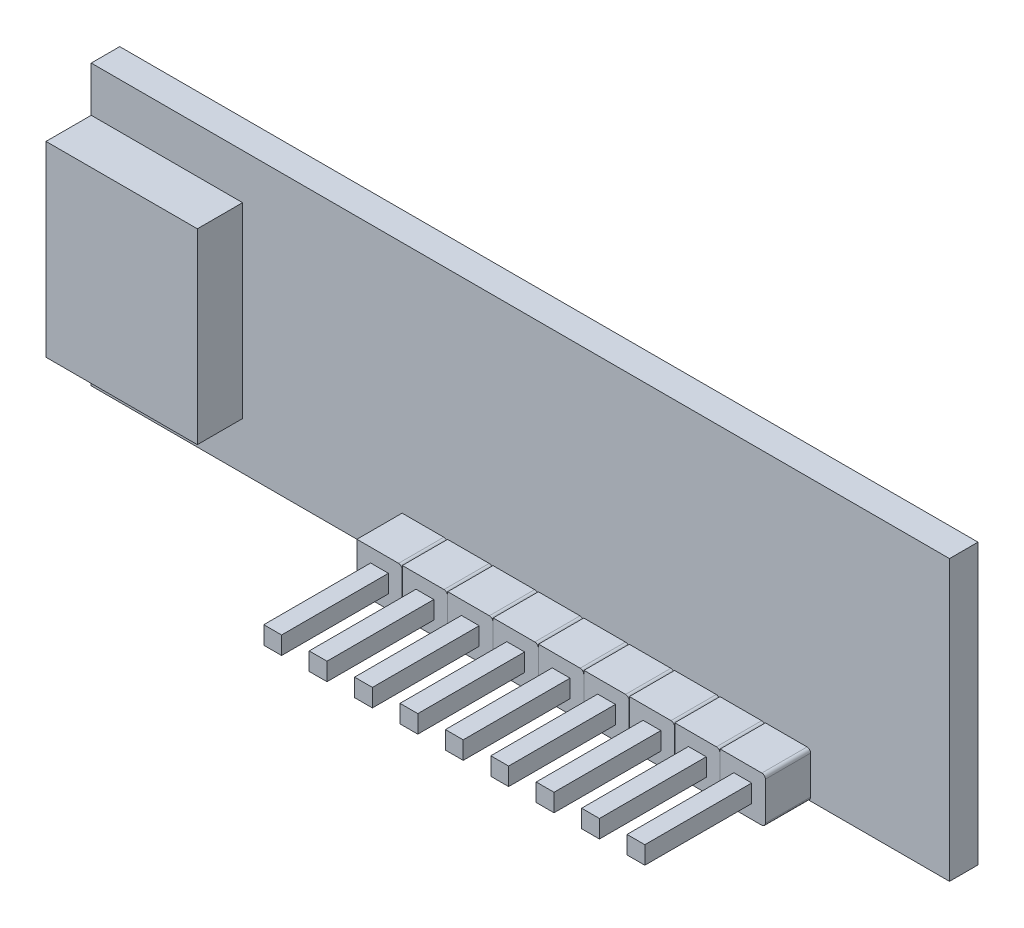
from build123d import *

# Parameters (mm, degrees)
SKETCH1_W             = 48.2
SKETCH1_H             = 15.7
MAIN_DEPTH            = 1.6
SKETCH2_W             = 2.54
SKETCH2_H             = 2.54
PINBASE_DEPTH         = 2.54
FILLET1_R             = 0.2
SKETCH3_W             = 1
SKETCH3_H             = 1
BOSS_EXTRUDE3_DEPTH   = 6
LPATTERN3_START       = 1.6
LPATTERN3_DEPTH       = 2.54
LPATTERN3_START_2     = -1.86
LPATTERN3_2_OUTLINE_W = 1
LPATTERN3_2_OUTLINE_H = 1
LPATTERN3_2_DEPTH     = 12
SKETCH5_W             = 8.5
SKETCH5_H             = 10.5
BOSS_EXTRUDE4_DEPTH   = 2.54
SKETCH6_W             = 1.8
SKETCH6_H             = 1.8
CUT_EXTRUDE1_DEPTH    = 6


# Read off the part's stored shape, not the designer's step: LPattern3
with BuildPart() as part:
    # Sketch1 → Main (new body)
    with BuildSketch(Plane.XY):
        Rectangle(SKETCH1_W, SKETCH1_H)
    extrude(amount=MAIN_DEPTH)

    # Sketch2 → PinBase (add)
    with BuildSketch(Plane.XY.offset(1.6)):
        with Locations((15.03, -6.58)):
            Rectangle(SKETCH2_W, SKETCH2_H)
    extrude(amount=PINBASE_DEPTH)

    # Fillet1
    fillet1_edges = [part.edges().sort_by_distance(p)[0] for p in [
        (13.76, -7.85, 2.87),
        (16.3, -7.85, 2.87),
        (16.3, -5.31, 2.87),
    ]]
    fillet(fillet1_edges, radius=FILLET1_R)

    # Sketch3 → Boss-Extrude3 (add, symmetric)
    with BuildSketch(Plane.XY.offset(4.14)):
        with Locations((15.03, -6.58)):
            Rectangle(SKETCH3_W, SKETCH3_H)
    extrude(amount=BOSS_EXTRUDE3_DEPTH, both=True)

    # LPattern3 outline → LPattern3 (add)
    with BuildSketch(Plane.XY.offset(LPATTERN3_START)):
        with BuildLine():
            Line((-6.44, -7.85), (-4.3, -7.85))
            ThreePointArc((-4.3, -7.85), (-4.158578644, -7.791421356), (-4.1, -7.65))
            Line((-4.1, -7.65), (-4.1, -5.51))
            ThreePointArc((-4.1, -5.51), (-4.158578644, -5.368578644), (-4.3, -5.31))
            Line((-4.3, -5.31), (-6.64, -5.31))
            Line((-6.64, -5.31), (-6.64, -7.65))
            ThreePointArc((-6.64, -7.65), (-6.581421356, -7.791421356), (-6.44, -7.85))
        make_face()
        with BuildLine():
            Line((-3.89, -7.85), (-1.75, -7.85))
            ThreePointArc((-1.75, -7.85), (-1.608578644, -7.791421356), (-1.55, -7.65))
            Line((-1.55, -7.65), (-1.55, -5.51))
            ThreePointArc((-1.55, -5.51), (-1.608578644, -5.368578644), (-1.75, -5.31))
            Line((-1.75, -5.31), (-4.09, -5.31))
            Line((-4.09, -5.31), (-4.09, -7.65))
            ThreePointArc((-4.09, -7.65), (-4.031421356, -7.791421356), (-3.89, -7.85))
        make_face()
        with BuildLine():
            Line((-1.34, -7.85), (0.8, -7.85))
            ThreePointArc((0.8, -7.85), (0.941421356, -7.791421356), (1, -7.65))
            Line((1, -7.65), (1, -5.51))
            ThreePointArc((1, -5.51), (0.941421356, -5.368578644), (0.8, -5.31))
            Line((0.8, -5.31), (-1.54, -5.31))
            Line((-1.54, -5.31), (-1.54, -7.65))
            ThreePointArc((-1.54, -7.65), (-1.481421356, -7.791421356), (-1.34, -7.85))
        make_face()
        with BuildLine():
            Line((1.21, -7.85), (3.35, -7.85))
            ThreePointArc((3.35, -7.85), (3.491421356, -7.791421356), (3.55, -7.65))
            Line((3.55, -7.65), (3.55, -5.51))
            ThreePointArc((3.55, -5.51), (3.491421356, -5.368578644), (3.35, -5.31))
            Line((3.35, -5.31), (1.01, -5.31))
            Line((1.01, -5.31), (1.01, -7.65))
            ThreePointArc((1.01, -7.65), (1.068578644, -7.791421356), (1.21, -7.85))
        make_face()
        with BuildLine():
            Line((3.76, -7.85), (5.9, -7.85))
            ThreePointArc((5.9, -7.85), (6.041421356, -7.791421356), (6.1, -7.65))
            Line((6.1, -7.65), (6.1, -5.51))
            ThreePointArc((6.1, -5.51), (6.041421356, -5.368578644), (5.9, -5.31))
            Line((5.9, -5.31), (3.56, -5.31))
            Line((3.56, -5.31), (3.56, -7.65))
            ThreePointArc((3.56, -7.65), (3.618578644, -7.791421356), (3.76, -7.85))
        make_face()
        with BuildLine():
            Line((6.31, -7.85), (8.45, -7.85))
            ThreePointArc((8.45, -7.85), (8.591421356, -7.791421356), (8.65, -7.65))
            Line((8.65, -7.65), (8.65, -5.51))
            ThreePointArc((8.65, -5.51), (8.591421356, -5.368578644), (8.45, -5.31))
            Line((8.45, -5.31), (6.11, -5.31))
            Line((6.11, -5.31), (6.11, -7.65))
            ThreePointArc((6.11, -7.65), (6.168578644, -7.791421356), (6.31, -7.85))
        make_face()
        with BuildLine():
            Line((8.86, -7.85), (11, -7.85))
            ThreePointArc((11, -7.85), (11.141421356, -7.791421356), (11.2, -7.65))
            Line((11.2, -7.65), (11.2, -5.51))
            ThreePointArc((11.2, -5.51), (11.141421356, -5.368578644), (11, -5.31))
            Line((11, -5.31), (8.66, -5.31))
            Line((8.66, -5.31), (8.66, -7.65))
            ThreePointArc((8.66, -7.65), (8.718578644, -7.791421356), (8.86, -7.85))
        make_face()
        with BuildLine():
            Line((11.41, -7.85), (13.55, -7.85))
            ThreePointArc((13.55, -7.85), (13.691421356, -7.791421356), (13.75, -7.65))
            Line((13.75, -7.65), (13.75, -5.51))
            ThreePointArc((13.75, -5.51), (13.691421356, -5.368578644), (13.55, -5.31))
            Line((13.55, -5.31), (11.21, -5.31))
            Line((11.21, -5.31), (11.21, -7.65))
            ThreePointArc((11.21, -7.65), (11.268578644, -7.791421356), (11.41, -7.85))
        make_face()
    extrude(amount=LPATTERN3_DEPTH)

    # LPattern3 2 outline → LPattern3 2 (add)
    with BuildSketch(Plane.XY.offset(LPATTERN3_START_2)):
        with Locations((12.48, -6.58)):
            Rectangle(LPATTERN3_2_OUTLINE_W, LPATTERN3_2_OUTLINE_H)
        with Locations((9.93, -6.58)):
            Rectangle(LPATTERN3_2_OUTLINE_W, LPATTERN3_2_OUTLINE_H)
        with Locations((7.38, -6.58)):
            Rectangle(LPATTERN3_2_OUTLINE_W, LPATTERN3_2_OUTLINE_H)
        with Locations((4.83, -6.58)):
            Rectangle(LPATTERN3_2_OUTLINE_W, LPATTERN3_2_OUTLINE_H)
        with Locations((2.28, -6.58)):
            Rectangle(LPATTERN3_2_OUTLINE_W, LPATTERN3_2_OUTLINE_H)
        with Locations((-0.27, -6.58)):
            Rectangle(LPATTERN3_2_OUTLINE_W, LPATTERN3_2_OUTLINE_H)
        with Locations((-2.82, -6.58)):
            Rectangle(LPATTERN3_2_OUTLINE_W, LPATTERN3_2_OUTLINE_H)
        with Locations((-5.37, -6.58)):
            Rectangle(LPATTERN3_2_OUTLINE_W, LPATTERN3_2_OUTLINE_H)
    extrude(amount=LPATTERN3_2_DEPTH)

    # Sketch5 → Boss-Extrude4 (add)
    with BuildSketch(Plane(origin=(-48.2, 0, 1.6), x_dir=(-1, 0, 0), z_dir=(0, 0, -1))):
        with Locations((-28.35, 0.06)):
            Rectangle(SKETCH5_W, SKETCH5_H)
    extrude(amount=-BOSS_EXTRUDE4_DEPTH)

    # Sketch6 → Cut-Extrude1 (cut)
    with BuildSketch(Plane.ZY.offset(24.1)):
        with Locations((2.87, 3.41)):
            Rectangle(SKETCH6_W, SKETCH6_H)
        with Locations((2.87, 1.24)):
            Rectangle(SKETCH6_W, SKETCH6_H)
        with Locations((2.87, -0.93)):
            Rectangle(SKETCH6_W, SKETCH6_H)
        with Locations((2.87, -3.1)):
            Rectangle(SKETCH6_W, SKETCH6_H)
    extrude(amount=-CUT_EXTRUDE1_DEPTH, mode=Mode.SUBTRACT)


solid = part.part
